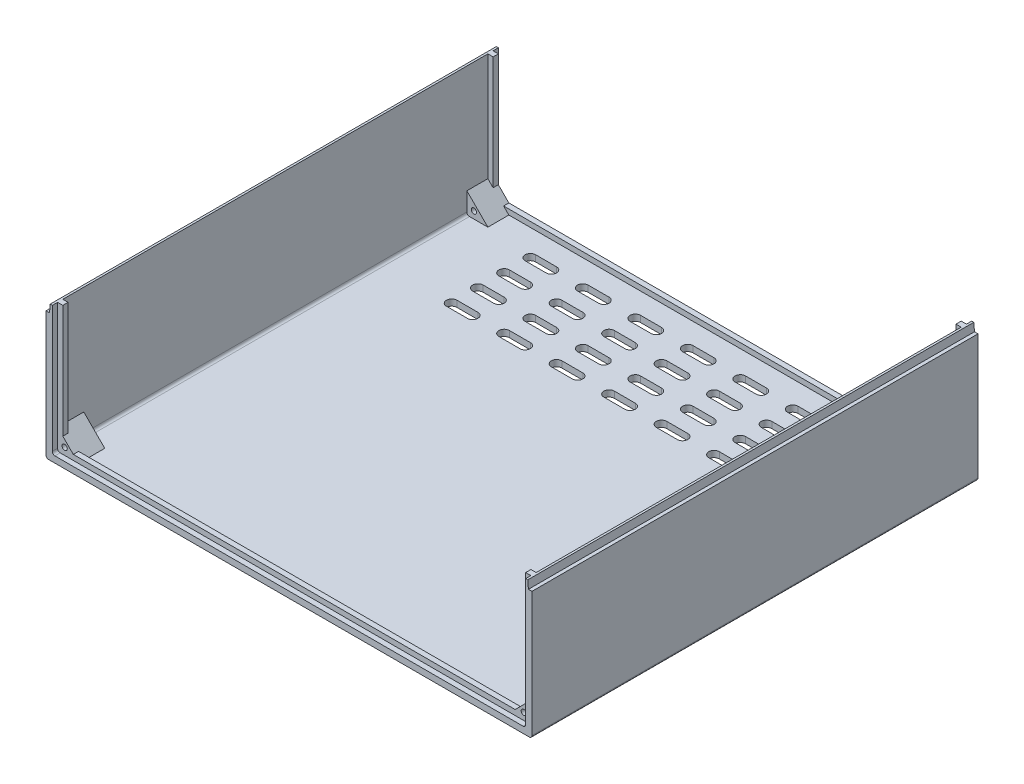
from build123d import *

# Parameters (mm, degrees)
EXTRUDE_1_DEPTH               = 170
EXTRUDE_START                 = 2
SKETCH_1_3_R                  = 1
EXTRUDE_2_DEPTH               = 10
EXTRUDE_3_DEPTH               = 2
FILLET_1_R                    = 1
EXTRUDE_START_2               = 158
SKETCH_1_5_R                  = 1
EXTRUDE_4_DEPTH               = 10
EXTRUDE_START_3               = 166
EXTRUDE_5_DEPTH               = 2
FILLET_2_R                    = 1
SKETCH_2_W                    = 1.3
SKETCH_2_H                    = 170
CUT_EXTRUDE_1_DEPTH           = 3
CHAMFER_1_SIZE                = 0.3
CHAMFER_1_SIZE_2              = 3.429015691
FILLET_3_R                    = 1
CUT_EXTRUDE_2_DEPTH           = 255.433645574
PATTERN_LINEAR_1_COUNT        = 4
PATTERN_LINEAR_1_PITCH        = 10
PATTERN_LINEAR_2_COUNT        = 4
PATTERN_LINEAR_2_PITCH        = 20
PATTERN_LINEAR_2_COPY_1_DEPTH = 255.433645574
PATTERN_LINEAR_2_COPY_2_DEPTH = 255.433645574
PATTERN_LINEAR_2_COPY_3_DEPTH = 255.433645574
PATTERN_LINEAR_2_COPY_4_DEPTH = 255.433645574
PATTERN_LINEAR_2_COPY_5_DEPTH = 255.433645574
PATTERN_LINEAR_2_COPY_6_DEPTH = 255.433645574
PATTERN_LINEAR_2_COPY_7_DEPTH = 255.433645574
PATTERN_LINEAR_2_COPY_8_DEPTH = 255.433645574
PATTERN_LINEAR_2_COPY_9_DEPTH = 255.433645574
PATTERN_LINEAR_3_COUNT        = 4
PATTERN_LINEAR_3_PITCH        = 20
PATTERN_LINEAR_3_COPY_1_DEPTH = 255.433645574
PATTERN_LINEAR_3_COPY_2_DEPTH = 255.433645574
PATTERN_LINEAR_3_COPY_3_DEPTH = 255.433645574
PATTERN_LINEAR_3_COPY_4_DEPTH = 255.433645574
PATTERN_LINEAR_3_COPY_5_DEPTH = 255.433645574
PATTERN_LINEAR_3_COPY_6_DEPTH = 255.433645574
PATTERN_LINEAR_3_COPY_7_DEPTH = 255.433645574
PATTERN_LINEAR_3_COPY_8_DEPTH = 255.433645574
PATTERN_LINEAR_3_COPY_9_DEPTH = 255.433645574


with BuildPart() as part:
    # Эскиз1 → Бобышка-Вытянуть1 (new body)
    with BuildSketch(Plane.XY):
        Polygon((0, 49.2), (-2.4, 49.2), (-2.4, -2.4), (182.8, -2.4), (182.8, 49.2), (180.4, 49.2), (180.4, 0), (0, 0), align=None)
    extrude(amount=EXTRUDE_1_DEPTH)

    # Эскиз1<3> → Бобышка-Вытянуть2 (add)
    # profile 1 of 2: a face of its own
    with BuildSketch(Plane.XY.offset(EXTRUDE_START)):
        Polygon((2, 6), (0, 8), (0, 0), (8, 0), (6, 2), align=None)
        with Locations((2.7, 2.7)):
            Circle(SKETCH_1_3_R, mode=Mode.SUBTRACT)
    # profile 2 of 2: a face of its own
    with BuildSketch(Plane.XY.offset(EXTRUDE_START)):
        Polygon((174.4, 2), (172.4, 0), (180.4, 0), (180.4, 8), (178.4, 6), align=None)
        with Locations((177.7, 2.7)):
            Circle(SKETCH_1_3_R, mode=Mode.SUBTRACT)
    extrude(amount=EXTRUDE_2_DEPTH)

    # Эскиз1<4> → Бобышка-Вытянуть3 (add)
    with BuildSketch(Plane.XY.offset(EXTRUDE_START)):
        Polygon((178.4, 49.2), (178.4, 6), (180.4, 8), (180.4, 49.2), align=None)
        Polygon((6, 2), (8, 0), (172.4, 0), (174.4, 2), align=None)
        Polygon((2, 49.2), (0, 49.2), (0, 8), (2, 6), align=None)
    extrude(amount=EXTRUDE_3_DEPTH)

    # Скругление1
    fillet_1_edges = [part.edges().sort_by_distance(p)[0] for p in [
        (182.8, -2.4, 85),
        (-2.4, -2.4, 85),
        (0, 0, 1),
        (180.4, 0, 1),
    ]]
    fillet(fillet_1_edges, radius=FILLET_1_R)

    # Эскиз1<5> → Бобышка-Вытянуть4 (add)
    # profile 1 of 2: a face of its own
    with BuildSketch(Plane.XY.offset(EXTRUDE_START_2)):
        Polygon((174.4, 2), (172.4, 0), (180.4, 0), (180.4, 8), (178.4, 6), align=None)
        with Locations((177.7, 2.7)):
            Circle(SKETCH_1_5_R, mode=Mode.SUBTRACT)
    # profile 2 of 2: a face of its own
    with BuildSketch(Plane.XY.offset(EXTRUDE_START_2)):
        Polygon((2, 6), (0, 8), (0, 0), (8, 0), (6, 2), align=None)
        with Locations((2.7, 2.7)):
            Circle(SKETCH_1_5_R, mode=Mode.SUBTRACT)
    extrude(amount=EXTRUDE_4_DEPTH)

    # Эскиз1<6> → Бобышка-Вытянуть5 (add)
    with BuildSketch(Plane.XY.offset(EXTRUDE_START_3)):
        Polygon((178.4, 49.2), (178.4, 6), (180.4, 8), (180.4, 49.2), align=None)
        Polygon((6, 2), (8, 0), (172.4, 0), (174.4, 2), align=None)
        Polygon((2, 49.2), (0, 49.2), (0, 8), (2, 6), align=None)
    extrude(amount=EXTRUDE_5_DEPTH)

    # Скругление2
    fillet_2_edges = [part.edges().sort_by_distance(p)[0] for p in [
        (180.4, 0, 85),
        (0, 0, 85),
    ]]
    fillet(fillet_2_edges, radius=FILLET_2_R)

    # Эскиз2 → Вырез-Вытянуть1 (cut)
    with BuildSketch(Plane(origin=(0, 49.2, 0), x_dir=(1, 0, 0), z_dir=(0, 1, 0))):
        with Locations((-1.75, -85)):
            Rectangle(SKETCH_2_W, SKETCH_2_H)
        with Locations((182.15, -85)):
            Rectangle(SKETCH_2_W, SKETCH_2_H)
    extrude(amount=-CUT_EXTRUDE_1_DEPTH, mode=Mode.SUBTRACT)

    # Фаска1
    # the kernel refuses this chamfer: 3.429015691, 0.3 mm, written as the material it takes off along each edge
    with BuildSketch(Plane(origin=(181.5, 49.2, -8.91418605), x_dir=(-0.9159861691531132, 0.4012098427509032, 0), z_dir=(0, 0, 1))) as chamfer_1_piece_1_section:
        Polygon((CHAMFER_1_SIZE * 0.915986169153, CHAMFER_1_SIZE * 0.401209842751), (-CHAMFER_1_SIZE_2 * 0.401209842731, CHAMFER_1_SIZE_2 * 0.915986169107), (0, 0), align=None)
    chamfer_1_piece_1 = extrude(amount=187.8283721, mode=Mode.PRIVATE)
    chamfer_1_piece_1 = split(chamfer_1_piece_1, bisect_by=Plane(origin=(181.433901825, 46.2, 85), z_dir=(0, 1, 0)), keep=Keep.TOP, mode=Mode.PRIVATE)
    add(chamfer_1_piece_1, mode=Mode.SUBTRACT)
    with BuildSketch(Plane(origin=(-1.1, 49.2, -8.91418605), x_dir=(0.9159861691531075, 0.40120984275091603, 0), z_dir=(0, 0, 1))) as chamfer_1_piece_2_section:
        Polygon((CHAMFER_1_SIZE * 0.915986169153, -CHAMFER_1_SIZE * 0.401209842751), (-CHAMFER_1_SIZE_2 * 0.401209842731, -CHAMFER_1_SIZE_2 * 0.915986169107), (0, 0), align=None)
    chamfer_1_piece_2 = extrude(amount=187.8283721, mode=Mode.PRIVATE)
    chamfer_1_piece_2 = split(chamfer_1_piece_2, bisect_by=Plane(origin=(-1.033901825, 46.2, 85), z_dir=(0, 1, 0)), keep=Keep.TOP, mode=Mode.PRIVATE)
    add(chamfer_1_piece_2, mode=Mode.SUBTRACT)

    # Скругление3
    fillet_3_edges = [part.edges().sort_by_distance(p)[0] for p in [
        (0, 0, 169),
        (180.4, 0, 169),
    ]]
    fillet(fillet_3_edges, radius=FILLET_3_R)

    # Эскиз3 → Вырез-Вытянуть2 (cut, through all)
    with BuildSketch(Plane(origin=(0, 0, 0), x_dir=(1, 0, 0), z_dir=(0, 1, 0))):
        with BuildLine():
            Line((86.2, -12), (94.2, -12))
            ThreePointArc((94.2, -12), (96.2, -14), (94.2, -16))
            Line((94.2, -16), (86.2, -16))
            ThreePointArc((86.2, -16), (84.2, -14), (86.2, -12))
        make_face()
    cut_extrude_2 = extrude(amount=-CUT_EXTRUDE_2_DEPTH, mode=Mode.SUBTRACT)

    # Линейный массив1: Вырез-Вытянуть2 ×4
    with Locations(*[(0, 0, i * PATTERN_LINEAR_1_PITCH) for i in range(1, PATTERN_LINEAR_1_COUNT)]):
        add(cut_extrude_2, mode=Mode.SUBTRACT)

    # Линейный массив2: Вырез-Вытянуть2 ×4
    with Locations(*[(-i * PATTERN_LINEAR_2_PITCH, 0, 0) for i in range(1, PATTERN_LINEAR_2_COUNT)]):
        add(cut_extrude_2, mode=Mode.SUBTRACT)

    # Линейный массив2 copy 1 sketch → Линейный массив2 copy 1 (cut, through all)
    with BuildSketch(Plane(origin=(-20, 0, 10), x_dir=(1, 0, 0), z_dir=(0, 1, 0))):
        with BuildLine():
            Line((86.2, -12), (94.2, -12))
            ThreePointArc((94.2, -12), (96.2, -14), (94.2, -16))
            Line((94.2, -16), (86.2, -16))
            ThreePointArc((86.2, -16), (84.2, -14), (86.2, -12))
        make_face()
    extrude(amount=-PATTERN_LINEAR_2_COPY_1_DEPTH, mode=Mode.SUBTRACT)

    # Линейный массив2 copy 2 sketch → Линейный массив2 copy 2 (cut, through all)
    with BuildSketch(Plane(origin=(-40, 0, 10), x_dir=(1, 0, 0), z_dir=(0, 1, 0))):
        with BuildLine():
            Line((86.2, -12), (94.2, -12))
            ThreePointArc((94.2, -12), (96.2, -14), (94.2, -16))
            Line((94.2, -16), (86.2, -16))
            ThreePointArc((86.2, -16), (84.2, -14), (86.2, -12))
        make_face()
    extrude(amount=-PATTERN_LINEAR_2_COPY_2_DEPTH, mode=Mode.SUBTRACT)

    # Линейный массив2 copy 3 sketch → Линейный массив2 copy 3 (cut, through all)
    with BuildSketch(Plane(origin=(-60, 0, 10), x_dir=(1, 0, 0), z_dir=(0, 1, 0))):
        with BuildLine():
            Line((86.2, -12), (94.2, -12))
            ThreePointArc((94.2, -12), (96.2, -14), (94.2, -16))
            Line((94.2, -16), (86.2, -16))
            ThreePointArc((86.2, -16), (84.2, -14), (86.2, -12))
        make_face()
    extrude(amount=-PATTERN_LINEAR_2_COPY_3_DEPTH, mode=Mode.SUBTRACT)

    # Линейный массив2 copy 4 sketch → Линейный массив2 copy 4 (cut, through all)
    with BuildSketch(Plane(origin=(-20, 0, 20), x_dir=(1, 0, 0), z_dir=(0, 1, 0))):
        with BuildLine():
            Line((86.2, -12), (94.2, -12))
            ThreePointArc((94.2, -12), (96.2, -14), (94.2, -16))
            Line((94.2, -16), (86.2, -16))
            ThreePointArc((86.2, -16), (84.2, -14), (86.2, -12))
        make_face()
    extrude(amount=-PATTERN_LINEAR_2_COPY_4_DEPTH, mode=Mode.SUBTRACT)

    # Линейный массив2 copy 5 sketch → Линейный массив2 copy 5 (cut, through all)
    with BuildSketch(Plane(origin=(-40, 0, 20), x_dir=(1, 0, 0), z_dir=(0, 1, 0))):
        with BuildLine():
            Line((86.2, -12), (94.2, -12))
            ThreePointArc((94.2, -12), (96.2, -14), (94.2, -16))
            Line((94.2, -16), (86.2, -16))
            ThreePointArc((86.2, -16), (84.2, -14), (86.2, -12))
        make_face()
    extrude(amount=-PATTERN_LINEAR_2_COPY_5_DEPTH, mode=Mode.SUBTRACT)

    # Линейный массив2 copy 6 sketch → Линейный массив2 copy 6 (cut, through all)
    with BuildSketch(Plane(origin=(-60, 0, 20), x_dir=(1, 0, 0), z_dir=(0, 1, 0))):
        with BuildLine():
            Line((86.2, -12), (94.2, -12))
            ThreePointArc((94.2, -12), (96.2, -14), (94.2, -16))
            Line((94.2, -16), (86.2, -16))
            ThreePointArc((86.2, -16), (84.2, -14), (86.2, -12))
        make_face()
    extrude(amount=-PATTERN_LINEAR_2_COPY_6_DEPTH, mode=Mode.SUBTRACT)

    # Линейный массив2 copy 7 sketch → Линейный массив2 copy 7 (cut, through all)
    with BuildSketch(Plane(origin=(-20, 0, 30), x_dir=(1, 0, 0), z_dir=(0, 1, 0))):
        with BuildLine():
            Line((86.2, -12), (94.2, -12))
            ThreePointArc((94.2, -12), (96.2, -14), (94.2, -16))
            Line((94.2, -16), (86.2, -16))
            ThreePointArc((86.2, -16), (84.2, -14), (86.2, -12))
        make_face()
    extrude(amount=-PATTERN_LINEAR_2_COPY_7_DEPTH, mode=Mode.SUBTRACT)

    # Линейный массив2 copy 8 sketch → Линейный массив2 copy 8 (cut, through all)
    with BuildSketch(Plane(origin=(-40, 0, 30), x_dir=(1, 0, 0), z_dir=(0, 1, 0))):
        with BuildLine():
            Line((86.2, -12), (94.2, -12))
            ThreePointArc((94.2, -12), (96.2, -14), (94.2, -16))
            Line((94.2, -16), (86.2, -16))
            ThreePointArc((86.2, -16), (84.2, -14), (86.2, -12))
        make_face()
    extrude(amount=-PATTERN_LINEAR_2_COPY_8_DEPTH, mode=Mode.SUBTRACT)

    # Линейный массив2 copy 9 sketch → Линейный массив2 copy 9 (cut, through all)
    with BuildSketch(Plane(origin=(-60, 0, 30), x_dir=(1, 0, 0), z_dir=(0, 1, 0))):
        with BuildLine():
            Line((86.2, -12), (94.2, -12))
            ThreePointArc((94.2, -12), (96.2, -14), (94.2, -16))
            Line((94.2, -16), (86.2, -16))
            ThreePointArc((86.2, -16), (84.2, -14), (86.2, -12))
        make_face()
    extrude(amount=-PATTERN_LINEAR_2_COPY_9_DEPTH, mode=Mode.SUBTRACT)

    # Линейный массив3: Вырез-Вытянуть2 ×4
    with Locations(*[(i * PATTERN_LINEAR_3_PITCH, 0, 0) for i in range(1, PATTERN_LINEAR_3_COUNT)]):
        add(cut_extrude_2, mode=Mode.SUBTRACT)

    # Линейный массив3 copy 1 sketch → Линейный массив3 copy 1 (cut, through all)
    with BuildSketch(Plane(origin=(20, 0, 10), x_dir=(1, 0, 0), z_dir=(0, 1, 0))):
        with BuildLine():
            Line((86.2, -12), (94.2, -12))
            ThreePointArc((94.2, -12), (96.2, -14), (94.2, -16))
            Line((94.2, -16), (86.2, -16))
            ThreePointArc((86.2, -16), (84.2, -14), (86.2, -12))
        make_face()
    extrude(amount=-PATTERN_LINEAR_3_COPY_1_DEPTH, mode=Mode.SUBTRACT)

    # Линейный массив3 copy 2 sketch → Линейный массив3 copy 2 (cut, through all)
    with BuildSketch(Plane(origin=(40, 0, 10), x_dir=(1, 0, 0), z_dir=(0, 1, 0))):
        with BuildLine():
            Line((86.2, -12), (94.2, -12))
            ThreePointArc((94.2, -12), (96.2, -14), (94.2, -16))
            Line((94.2, -16), (86.2, -16))
            ThreePointArc((86.2, -16), (84.2, -14), (86.2, -12))
        make_face()
    extrude(amount=-PATTERN_LINEAR_3_COPY_2_DEPTH, mode=Mode.SUBTRACT)

    # Линейный массив3 copy 3 sketch → Линейный массив3 copy 3 (cut, through all)
    with BuildSketch(Plane(origin=(60, 0, 10), x_dir=(1, 0, 0), z_dir=(0, 1, 0))):
        with BuildLine():
            Line((86.2, -12), (94.2, -12))
            ThreePointArc((94.2, -12), (96.2, -14), (94.2, -16))
            Line((94.2, -16), (86.2, -16))
            ThreePointArc((86.2, -16), (84.2, -14), (86.2, -12))
        make_face()
    extrude(amount=-PATTERN_LINEAR_3_COPY_3_DEPTH, mode=Mode.SUBTRACT)

    # Линейный массив3 copy 4 sketch → Линейный массив3 copy 4 (cut, through all)
    with BuildSketch(Plane(origin=(20, 0, 20), x_dir=(1, 0, 0), z_dir=(0, 1, 0))):
        with BuildLine():
            Line((86.2, -12), (94.2, -12))
            ThreePointArc((94.2, -12), (96.2, -14), (94.2, -16))
            Line((94.2, -16), (86.2, -16))
            ThreePointArc((86.2, -16), (84.2, -14), (86.2, -12))
        make_face()
    extrude(amount=-PATTERN_LINEAR_3_COPY_4_DEPTH, mode=Mode.SUBTRACT)

    # Линейный массив3 copy 5 sketch → Линейный массив3 copy 5 (cut, through all)
    with BuildSketch(Plane(origin=(40, 0, 20), x_dir=(1, 0, 0), z_dir=(0, 1, 0))):
        with BuildLine():
            Line((86.2, -12), (94.2, -12))
            ThreePointArc((94.2, -12), (96.2, -14), (94.2, -16))
            Line((94.2, -16), (86.2, -16))
            ThreePointArc((86.2, -16), (84.2, -14), (86.2, -12))
        make_face()
    extrude(amount=-PATTERN_LINEAR_3_COPY_5_DEPTH, mode=Mode.SUBTRACT)

    # Линейный массив3 copy 6 sketch → Линейный массив3 copy 6 (cut, through all)
    with BuildSketch(Plane(origin=(60, 0, 20), x_dir=(1, 0, 0), z_dir=(0, 1, 0))):
        with BuildLine():
            Line((86.2, -12), (94.2, -12))
            ThreePointArc((94.2, -12), (96.2, -14), (94.2, -16))
            Line((94.2, -16), (86.2, -16))
            ThreePointArc((86.2, -16), (84.2, -14), (86.2, -12))
        make_face()
    extrude(amount=-PATTERN_LINEAR_3_COPY_6_DEPTH, mode=Mode.SUBTRACT)

    # Линейный массив3 copy 7 sketch → Линейный массив3 copy 7 (cut, through all)
    with BuildSketch(Plane(origin=(20, 0, 30), x_dir=(1, 0, 0), z_dir=(0, 1, 0))):
        with BuildLine():
            Line((86.2, -12), (94.2, -12))
            ThreePointArc((94.2, -12), (96.2, -14), (94.2, -16))
            Line((94.2, -16), (86.2, -16))
            ThreePointArc((86.2, -16), (84.2, -14), (86.2, -12))
        make_face()
    extrude(amount=-PATTERN_LINEAR_3_COPY_7_DEPTH, mode=Mode.SUBTRACT)

    # Линейный массив3 copy 8 sketch → Линейный массив3 copy 8 (cut, through all)
    with BuildSketch(Plane(origin=(40, 0, 30), x_dir=(1, 0, 0), z_dir=(0, 1, 0))):
        with BuildLine():
            Line((86.2, -12), (94.2, -12))
            ThreePointArc((94.2, -12), (96.2, -14), (94.2, -16))
            Line((94.2, -16), (86.2, -16))
            ThreePointArc((86.2, -16), (84.2, -14), (86.2, -12))
        make_face()
    extrude(amount=-PATTERN_LINEAR_3_COPY_8_DEPTH, mode=Mode.SUBTRACT)

    # Линейный массив3 copy 9 sketch → Линейный массив3 copy 9 (cut, through all)
    with BuildSketch(Plane(origin=(60, 0, 30), x_dir=(1, 0, 0), z_dir=(0, 1, 0))):
        with BuildLine():
            Line((86.2, -12), (94.2, -12))
            ThreePointArc((94.2, -12), (96.2, -14), (94.2, -16))
            Line((94.2, -16), (86.2, -16))
            ThreePointArc((86.2, -16), (84.2, -14), (86.2, -12))
        make_face()
    extrude(amount=-PATTERN_LINEAR_3_COPY_9_DEPTH, mode=Mode.SUBTRACT)


solid = part.part
